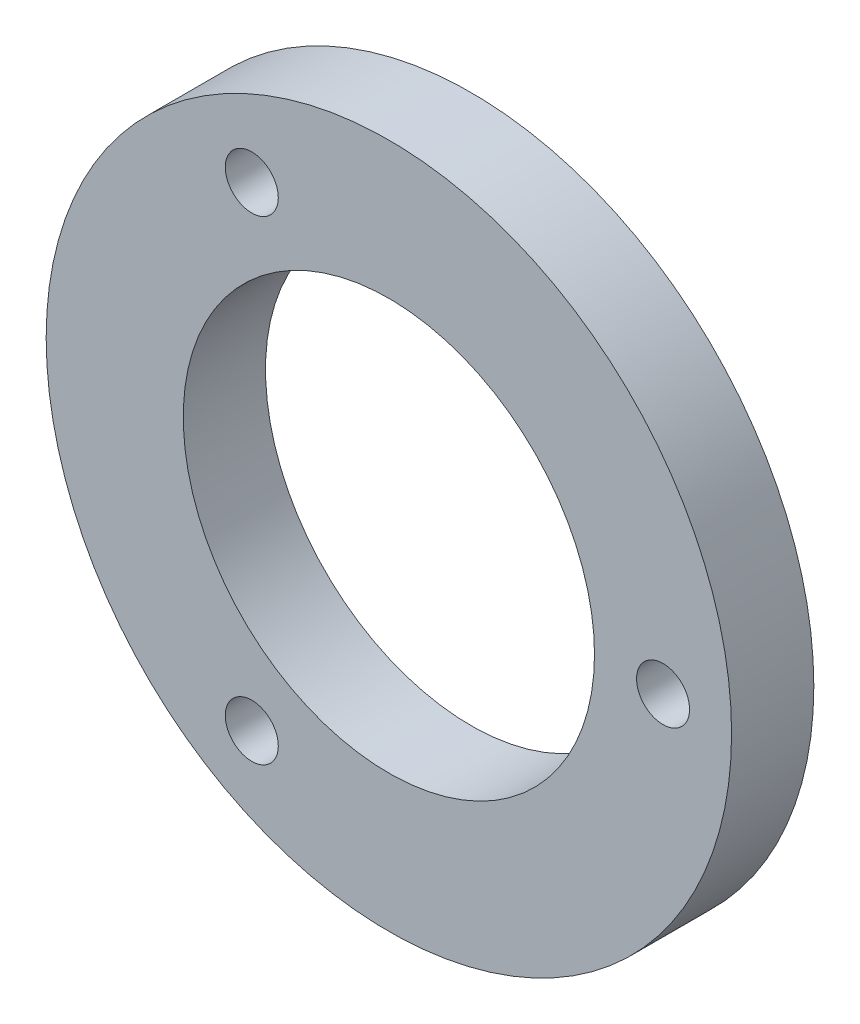
from build123d import *

# Parameters (mm, degrees)
ESQUISSE1_R              = 37.5
BOSS_EXTRU_1_DEPTH       = 9
ESQUISSE2_R              = 22.5
ENL_V_MAT_EXTRU_1_DEPTH  = 30.5
D_GAGEMENT_M51_OUTLINE_R = 2.9
D_GAGEMENT_M51_DEPTH     = 9


# Read off the part's stored shape, not the designer's step: Dégagement M51
with BuildPart() as part:
    # Esquisse1 → Boss.-Extru.1 (new body)
    with BuildSketch(Plane.XY):
        Circle(ESQUISSE1_R)
    extrude(amount=BOSS_EXTRU_1_DEPTH)

    # Esquisse2 → Enlèv. mat.-Extru.1 (cut)
    with BuildSketch(Plane.XY.offset(9)):
        Circle(ESQUISSE2_R)
    extrude(amount=-ENL_V_MAT_EXTRU_1_DEPTH, mode=Mode.SUBTRACT)

    # Dégagement M51 outline → Dégagement M51 (cut)
    with BuildSketch(Plane.XY):
        with Locations((-15, -25.980762114)):
            Circle(D_GAGEMENT_M51_OUTLINE_R)
        with Locations((-15, 25.980762114)):
            Circle(D_GAGEMENT_M51_OUTLINE_R)
        with Locations((30, 0)):
            Circle(D_GAGEMENT_M51_OUTLINE_R)
    extrude(amount=D_GAGEMENT_M51_DEPTH, mode=Mode.SUBTRACT)


solid = part.part
